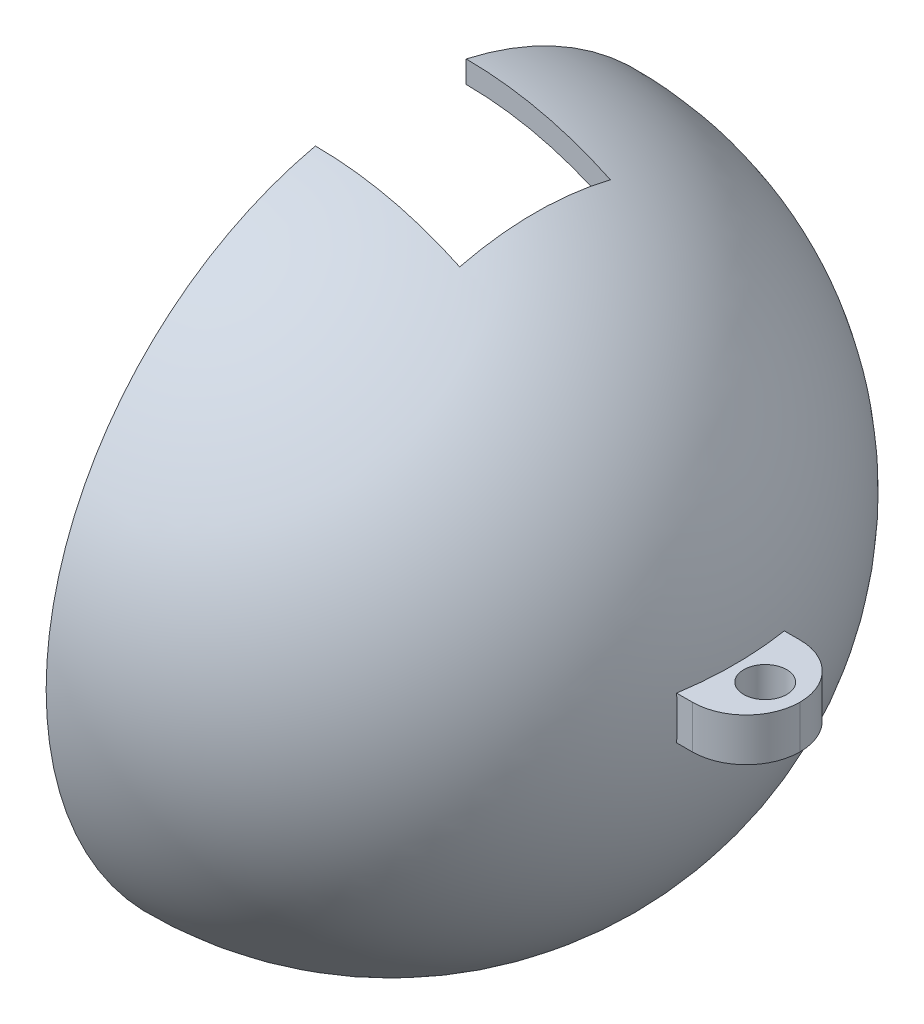
from build123d import *

# Parameters (mm, degrees)
REVOLVE_2_ANGLE     = 180
SKETCH_2_W          = 5
SKETCH_2_H          = 2
EXTRUDE_1_DEPTH     = 4
SKETCH_3_R          = 1
CUT_EXTRUDE_1_DEPTH = 5
FILLET_1_R          = 2.5
FILLET_2_R          = 2.5
SKETCH_4_W          = 6.7
SKETCH_4_H          = 7
CUT_EXTRUDE_2_DEPTH = 15


with BuildPart() as part:
    # 草图1 → 旋转2 (revolve)
    with BuildSketch(Plane(origin=(0, 0, 0), x_dir=(0, 0, -1), z_dir=(1, 0, 0))):
        with BuildLine():
            Line((-16, 0), (-15, 0))
            ThreePointArc((-15, 0), (0, 15), (15, 0))
            Line((15, 0), (16, 0))
            ThreePointArc((16, 0), (0, 16), (-16, 0))
        make_face()
    revolve(axis=Axis((0, 0, -15), (0, 0, -1)), revolution_arc=REVOLVE_2_ANGLE)

    # 草图2 → 凸台-拉伸1 (add)
    with BuildSketch(Plane(origin=(15, 0, 0), x_dir=(0, 0, -1), z_dir=(1, 0, 0))):
        Rectangle(SKETCH_2_W, SKETCH_2_H)
    extrude(amount=EXTRUDE_1_DEPTH)

    # 草图3 → 切除-拉伸1 (cut)
    with BuildSketch(Plane(origin=(0, 1, 0), x_dir=(1, 0, 0), z_dir=(0, 1, 0))):
        with Locations(Location((17.385905148, 0, 0), (0, 0, 270))):
            Circle(SKETCH_3_R)
    extrude(amount=-CUT_EXTRUDE_1_DEPTH, mode=Mode.SUBTRACT)

    # 圆角1
    fillet_1_edges = [part.edges().sort_by_distance(p)[0] for p in [
        (19, 0, -2.5),
    ]]
    fillet(fillet_1_edges, radius=FILLET_1_R)

    # 圆角2
    fillet_2_edges = [part.edges().sort_by_distance(p)[0] for p in [
        (19, 0, 2.5),
    ]]
    fillet(fillet_2_edges, radius=FILLET_2_R - 0.0001)  # a hair under: the kernel refuses the full size

    # 草图4 → 切除-拉伸2 (cut)
    with BuildSketch(Plane(origin=(0, 18.626931023, 0), x_dir=(1, 0, 0), z_dir=(0, 1, 0))):
        with Locations((3.35, 0)):
            Rectangle(SKETCH_4_W, SKETCH_4_H)
    extrude(amount=-CUT_EXTRUDE_2_DEPTH, mode=Mode.SUBTRACT)


solid = part.part
